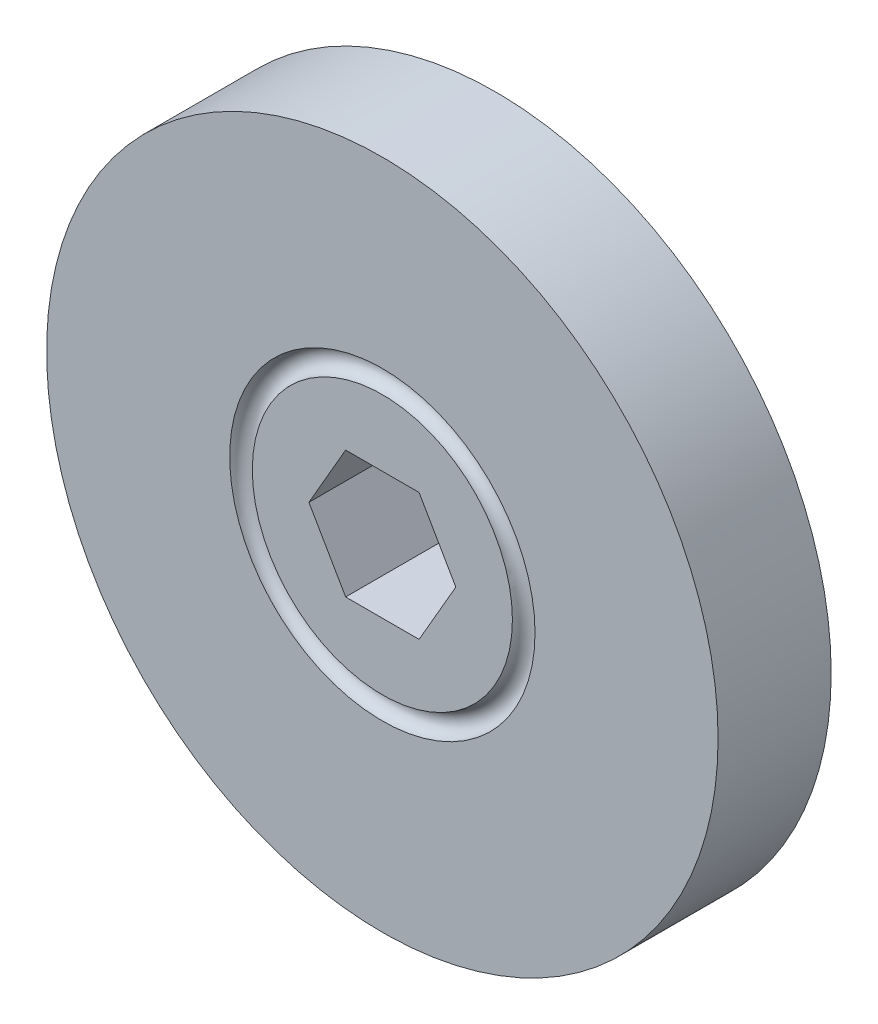
from build123d import *

# Parameters (mm, degrees)
CUT_EXTRUDE1_REACH = 45.849


with BuildPart() as part:
    # Sketch1 → Revolve1 (revolve)
    with BuildSketch(Plane(origin=(0, 0, 0), x_dir=(0, 0, -1), z_dir=(1, 0, 0))):
        with BuildLine():
            Line((-5.08, 30.1625), (5.08, 30.1625))
            Line((5.08, 30.1625), (5.08, 13.716))
            ThreePointArc((5.08, 13.716), (4.064, 12.7), (5.08, 11.684))
            Line((5.08, 11.684), (5.08, 0))
            Line((5.08, 0), (-5.08, 0))
            Line((-5.08, 0), (-5.08, 11.684))
            ThreePointArc((-5.08, 11.684), (-4.064, 12.7), (-5.08, 13.716))
            Line((-5.08, 13.716), (-5.08, 30.1625))
        make_face()
    revolve(axis=Axis((0, 0, 5.08), (0, 0, -1)))

    # Sketch2 → Cut-Extrude1 (cut, up to next)
    with BuildSketch(Plane.XY.offset(5.08), mode=Mode.PRIVATE) as cut_extrude1_sk1:
        Polygon((-3.299556788, 5.715), (-6.599113577, 0), (-3.299556788, -5.715), (3.299556788, -5.715), (6.599113577, 0), (3.299556788, 5.715), align=None)
    cut_extrude1_tool1 = extrude(cut_extrude1_sk1.sketch, amount=-CUT_EXTRUDE1_REACH, mode=Mode.PRIVATE) & part.part
    add(cut_extrude1_tool1.solids().sort_by_distance((0, 0, 5.08))[0], mode=Mode.SUBTRACT)


solid = part.part
